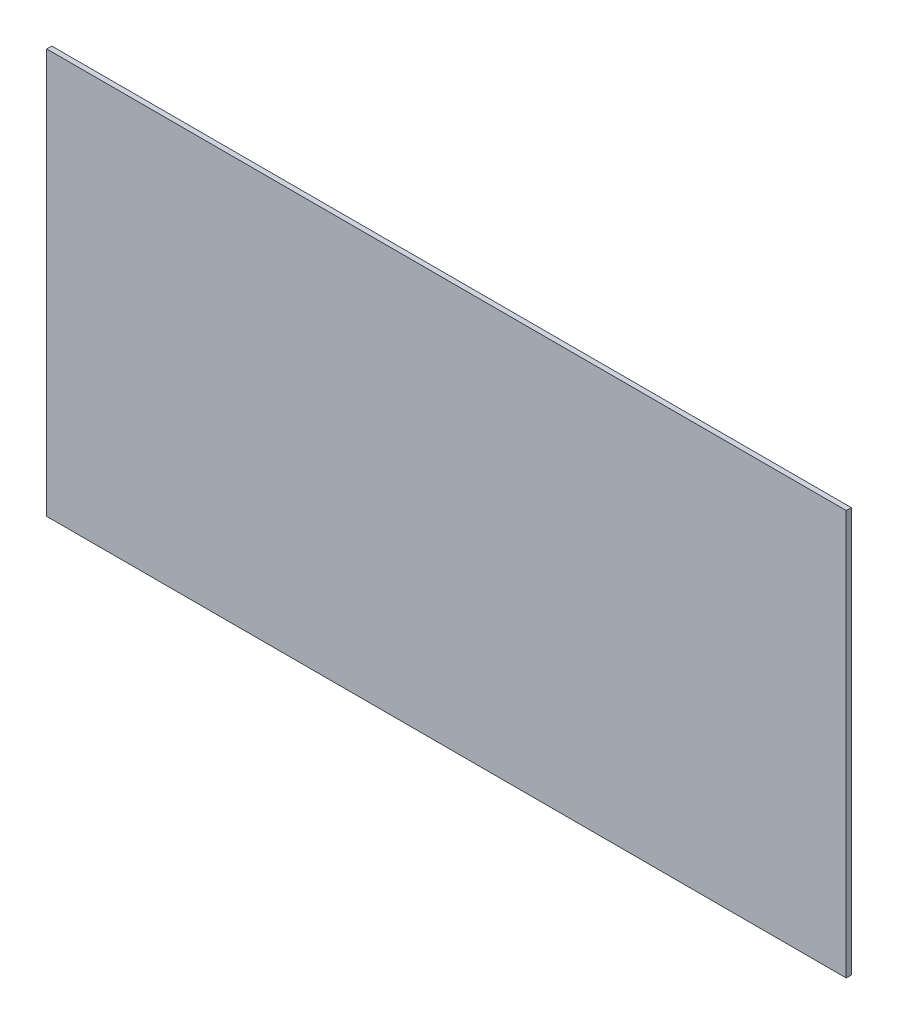
from build123d import *

# Parameters (mm, degrees)
SKETCH1_W           = 752.475
SKETCH1_H           = 381
BOSS_EXTRUDE1_DEPTH = 4.7625


with BuildPart() as part:
    # Sketch1 → Boss-Extrude1 (new body)
    with BuildSketch(Plane.XY):
        with Locations((376.2375, -190.5)):
            Rectangle(SKETCH1_W, SKETCH1_H)
    extrude(amount=BOSS_EXTRUDE1_DEPTH)


solid = part.part
